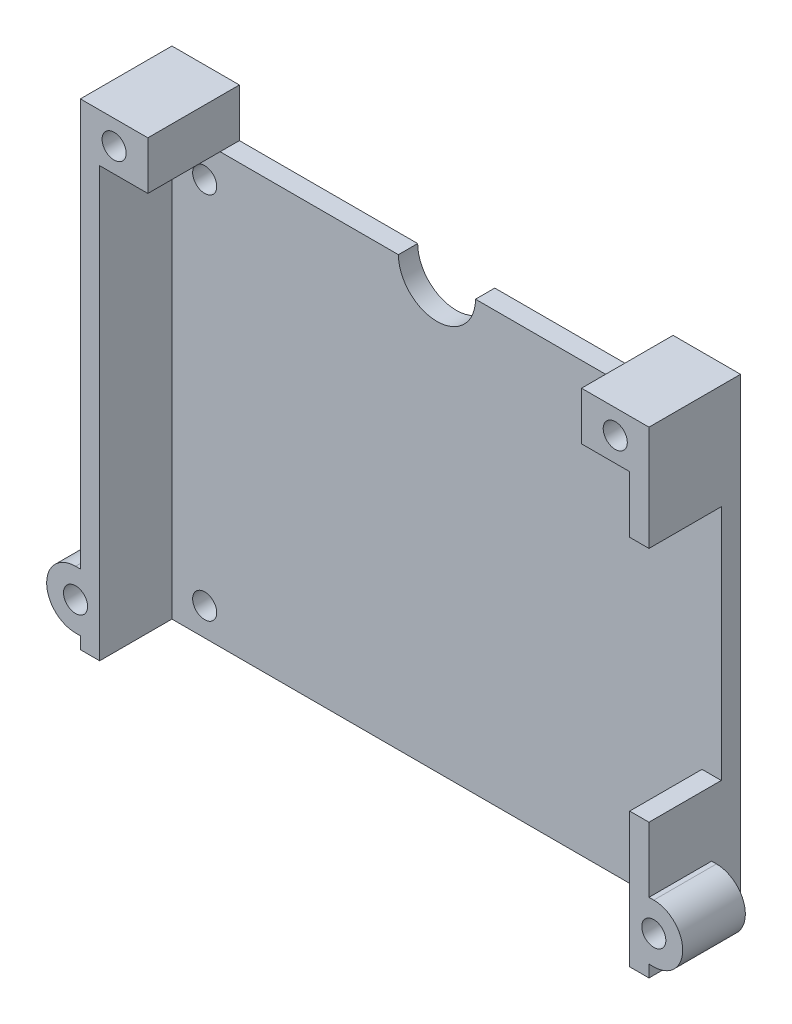
from build123d import *

# Parameters (mm, degrees)
BOSS_EXTRUDE1_DEPTH = 44.5
SKETCH2_W           = 7.5
SKETCH2_H           = 24.6
CUT_EXTRUDE1_DEPTH  = 10
BOSS_EXTRUDE2_DEPTH = 9.5
CUT_EXTRUDE2_DEPTH  = 11
SKETCH4_W           = 7
SKETCH4_H           = 9.5
BOSS_EXTRUDE3_DEPTH = 5
SKETCH5_R           = 1.25
CUT_EXTRUDE3_DEPTH  = 81.291655855
SKETCH7_R           = 1.25
CUT_EXTRUDE4_DEPTH  = 10
SKETCH8_R           = 4
CUT_EXTRUDE5_DEPTH  = 81.291655855
CUT_EXTRUDE6_DEPTH  = 3
BOSS_EXTRUDE4_DEPTH = 3


with BuildPart() as part:
    # Sketch1 → Boss-Extrude1 (new body)
    with BuildSketch(Plane(origin=(0, 0, 0), x_dir=(1, 0, 0), z_dir=(0, 1, 0))):
        Polygon((0, 0), (2, 0), (2, 7.5), (57, 7.5), (57, 0), (59, 0), (59, 9.5), (0, 9.5), align=None)
    extrude(amount=BOSS_EXTRUDE1_DEPTH)

    # Sketch2 → Cut-Extrude1 (cut)
    with BuildSketch(Plane(origin=(59, 0, 0), x_dir=(0, 0, -1), z_dir=(1, 0, 0))):
        with Locations((3.75, 26.3)):
            Rectangle(SKETCH2_W, SKETCH2_H)
    extrude(amount=-CUT_EXTRUDE1_DEPTH, mode=Mode.SUBTRACT)

    # Sketch3 → Boss-Extrude2 (add)
    with BuildSketch(Plane(origin=(0, 0, -9.5), x_dir=(-1, 0, 0), z_dir=(0, 0, -1))):
        with BuildLine():
            Line((-59, 5.395643924), (-59, 7.25))
            Line((-59, 7.25), (-59.5, 7.25))
            ThreePointArc((-59.5, 7.25), (-62.5, 4.25), (-59.5, 1.25))
            Line((-59.5, 1.25), (-59, 1.25))
            Line((-59, 1.25), (-59, 3.104356076))
            ThreePointArc((-59, 3.104356076), (-60.75, 4.25), (-59, 5.395643924))
        make_face()
        with BuildLine():
            Line((0.5, 7.25), (0, 7.25))
            Line((0, 7.25), (0, 5.395643924))
            ThreePointArc((0, 5.395643924), (1.75, 4.25), (0, 3.104356076))
            Line((0, 3.104356076), (0, 1.25))
            Line((0, 1.25), (0.5, 1.25))
            ThreePointArc((0.5, 1.25), (3.5, 4.25), (0.5, 7.25))
        make_face()
    extrude(amount=-BOSS_EXTRUDE2_DEPTH)

    # Sketch3<3> → Cut-Extrude2 (cut)
    with BuildSketch(Plane(origin=(0, 0, -9.5), x_dir=(-1, 0, 0), z_dir=(0, 0, -1))):
        with BuildLine():
            ThreePointArc((-59, 3.104356076), (-58.25, 4.25), (-59, 5.395643924))
            Line((-59, 5.395643924), (-59, 3.104356076))
        make_face()
        with BuildLine():
            Line((0, 3.104356076), (0, 5.395643924))
            ThreePointArc((0, 5.395643924), (-0.75, 4.25), (0, 3.104356076))
        make_face()
    extrude(amount=-CUT_EXTRUDE2_DEPTH, mode=Mode.SUBTRACT)

    # Sketch4 → Boss-Extrude3 (add)
    with BuildSketch(Plane(origin=(0, 44.5, 0), x_dir=(1, 0, 0), z_dir=(0, 1, 0))):
        with Locations((3.5, 4.75)):
            Rectangle(SKETCH4_W, SKETCH4_H)
        with Locations((55.5, 4.75)):
            Rectangle(SKETCH4_W, SKETCH4_H)
    extrude(amount=BOSS_EXTRUDE3_DEPTH)

    # Sketch5 → Cut-Extrude3 (cut, through all)
    with BuildSketch(Plane(origin=(0, 0, -9.5), x_dir=(-1, 0, 0), z_dir=(0, 0, -1))):
        with Locations((-55.5, 47)):
            Circle(SKETCH5_R)
        with Locations((-3.5, 47)):
            Circle(SKETCH5_R)
    extrude(amount=-CUT_EXTRUDE3_DEPTH, mode=Mode.SUBTRACT)

    # Sketch7 → Cut-Extrude4 (cut)
    with BuildSketch(Plane(origin=(0, 0, -9.5), x_dir=(-1, 0, 0), z_dir=(0, 0, -1))):
        with Locations((-5.4, 2.9)):
            Circle(SKETCH7_R)
        with Locations((-53.6, 2.9)):
            Circle(SKETCH7_R)
        with Locations((-53.6, 41.2)):
            Circle(SKETCH7_R)
        with Locations((-5.4, 41.2)):
            Circle(SKETCH7_R)
    extrude(amount=-CUT_EXTRUDE4_DEPTH, mode=Mode.SUBTRACT)

    # Sketch8 → Cut-Extrude5 (cut, through all)
    with BuildSketch(Plane(origin=(0, 0, -9.5), x_dir=(-1, 0, 0), z_dir=(0, 0, -1))):
        with Locations((-29.5, 44.5)):
            Circle(SKETCH8_R)
    extrude(amount=-CUT_EXTRUDE5_DEPTH, mode=Mode.SUBTRACT)

    # Sketch3<4> → Cut-Extrude6 (cut)
    with BuildSketch(Plane(origin=(0, 0, -9.5), x_dir=(-1, 0, 0), z_dir=(0, 0, -1))):
        with BuildLine():
            Line((-59, 5.395643924), (-59, 7.25))
            Line((-59, 7.25), (-59.5, 7.25))
            ThreePointArc((-59.5, 7.25), (-62.5, 4.25), (-59.5, 1.25))
            Line((-59.5, 1.25), (-59, 1.25))
            Line((-59, 1.25), (-59, 3.104356076))
            ThreePointArc((-59, 3.104356076), (-60.75, 4.25), (-59, 5.395643924))
        make_face()
        with BuildLine():
            Line((0.5, 7.25), (0, 7.25))
            Line((0, 7.25), (0, 5.395643924))
            ThreePointArc((0, 5.395643924), (1.75, 4.25), (0, 3.104356076))
            Line((0, 3.104356076), (0, 1.25))
            Line((0, 1.25), (0.5, 1.25))
            ThreePointArc((0.5, 1.25), (3.5, 4.25), (0.5, 7.25))
        make_face()
    extrude(amount=-CUT_EXTRUDE6_DEPTH, mode=Mode.SUBTRACT)

    # Sketch3<5> → Boss-Extrude4 (add)
    with BuildSketch(Plane(origin=(0, 0, -9.5), x_dir=(-1, 0, 0), z_dir=(0, 0, -1))):
        with BuildLine():
            ThreePointArc((-59, 3.104356076), (-58.25, 4.25), (-59, 5.395643924))
            Line((-59, 5.395643924), (-59, 3.104356076))
        make_face()
        with BuildLine():
            Line((0, 3.104356076), (0, 5.395643924))
            ThreePointArc((0, 5.395643924), (-0.75, 4.25), (0, 3.104356076))
        make_face()
    extrude(amount=-BOSS_EXTRUDE4_DEPTH)


solid = part.part
